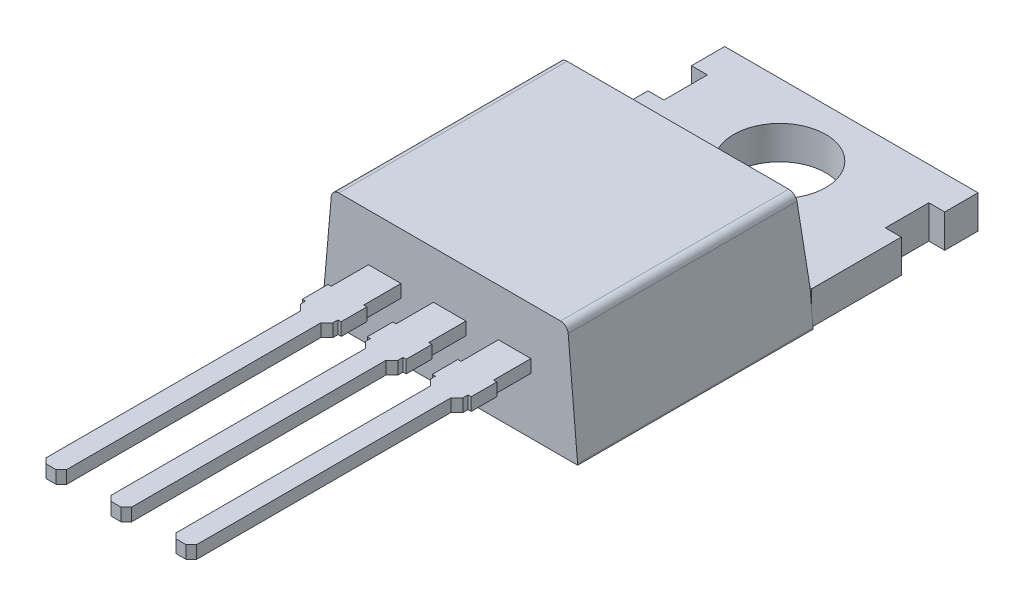
from build123d import *

# Parameters (mm, degrees)
BOSS_EXTRUDE1_DEPTH  = 9.2
FILLET1_R            = 0.3
CUT_EXTRUDE1_DEPTH   = 19.2
SKETCH3_W            = 9.9
SKETCH3_H            = 1.3
BOSS_EXTRUDE2_DEPTH  = 6.5
SKETCH4_W            = 0.621842352
SKETCH4_H            = 1.7
CUT_EXTRUDE3_DEPTH   = 16.5
SKETCH5_R            = 1.8
CUT_EXTRUDE4_DEPTH   = 16.5
SKETCH8_W            = 1.27
SKETCH8_H            = 0.5
BOSS_EXTRUDE4_DEPTH  = 1.46
SKETCH9_W            = 1.52
SKETCH9_H            = 0.5
BOSS_EXTRUDE5_DEPTH  = 1
SKETCH10_W           = 1.27
SKETCH10_H           = 0.5
BOSS_EXTRUDE6_DEPTH  = 0.5
SKETCH11_W           = 0.8
SKETCH11_H           = 0.5
BOSS_EXTRUDE7_DEPTH  = 10.08
CHAMFER1_SIZE        = 0.3
CHAMFER2_SIZE        = 0.2
BOSS_EXTRUDE10_DEPTH = 0.05


with BuildPart() as part:
    # Sketch1 → Boss-Extrude1 (new body)
    with BuildSketch(Plane.XY):
        Polygon((1.031077827, 0), (-8.968922173, 0), (-8.575223187, 4.5), (0.637378841, 4.5), align=None)
    extrude(amount=BOSS_EXTRUDE1_DEPTH)

    # Fillet1
    fillet1_edges = [part.edges().sort_by_distance(p)[0] for p in [
        (-8.575223187, 4.5, 4.6),
        (0.637378841, 4.5, 4.6),
    ]]
    fillet(fillet1_edges, radius=FILLET1_R)

    # Sketch2 → Cut-Extrude1 (cut)
    with BuildSketch(Plane(origin=(5, 0, 0), x_dir=(0, 0, -1), z_dir=(1, 0, 0))):
        Polygon((0, 4.5), (-0.279963723, 4.5), (0, 1.3), align=None)
    extrude(amount=-CUT_EXTRUDE1_DEPTH, mode=Mode.SUBTRACT)

    # Sketch3 → Boss-Extrude2 (add)
    with BuildSketch(Plane(origin=(0, 0, 0), x_dir=(-1, 0, 0), z_dir=(0, 0, -1))):
        with Locations((3.968922173, 0.65)):
            Rectangle(SKETCH3_W, SKETCH3_H)
    extrude(amount=BOSS_EXTRUDE2_DEPTH)

    # Sketch4 → Cut-Extrude3 (cut)
    with BuildSketch(Plane(origin=(0, 1.3, 0), x_dir=(1, 0, 0), z_dir=(0, 1, 0))):
        with Locations((-8.608000997, 4.35)):
            Rectangle(SKETCH4_W, SKETCH4_H)
        with Locations((0.670156651, 4.35)):
            Rectangle(SKETCH4_W, SKETCH4_H)
    extrude(amount=-CUT_EXTRUDE3_DEPTH, mode=Mode.SUBTRACT)

    # Sketch5 → Cut-Extrude4 (cut)
    with BuildSketch(Plane(origin=(0, 1.3, 0), x_dir=(1, 0, 0), z_dir=(0, 1, 0))):
        with Locations(Location((-3.968922173, 3.7, 0), (0, 0, 270))):
            Circle(SKETCH5_R)
    extrude(amount=-CUT_EXTRUDE4_DEPTH, mode=Mode.SUBTRACT)

    # Sketch8 → Boss-Extrude4 (add)
    with BuildSketch(Plane.XY.offset(9.2)):
        with Locations((-1.428922173, 2.4)):
            Rectangle(SKETCH8_W, SKETCH8_H)
        with Locations((-3.968922173, 2.4)):
            Rectangle(SKETCH8_W, SKETCH8_H)
        with Locations((-6.508922173, 2.4)):
            Rectangle(SKETCH8_W, SKETCH8_H)
    extrude(amount=BOSS_EXTRUDE4_DEPTH)

    # Sketch9 → Boss-Extrude5 (add)
    with BuildSketch(Plane.XY.offset(10.66)):
        with Locations((-3.968922173, 2.4)):
            Rectangle(SKETCH9_W, SKETCH9_H)
        with Locations((-1.428922173, 2.4)):
            Rectangle(SKETCH9_W, SKETCH9_H)
        with Locations((-6.508922173, 2.4)):
            Rectangle(SKETCH9_W, SKETCH9_H)
    extrude(amount=BOSS_EXTRUDE5_DEPTH)

    # Sketch10 → Boss-Extrude6 (add)
    with BuildSketch(Plane.XY.offset(11.66)):
        with Locations((-3.968922173, 2.4)):
            Rectangle(SKETCH10_W, SKETCH10_H)
        with Locations((-1.428922173, 2.4)):
            Rectangle(SKETCH10_W, SKETCH10_H)
        with Locations((-6.508922173, 2.4)):
            Rectangle(SKETCH10_W, SKETCH10_H)
    extrude(amount=BOSS_EXTRUDE6_DEPTH)

    # Sketch11 → Boss-Extrude7 (add)
    with BuildSketch(Plane.XY.offset(12.16)):
        with Locations((-3.968922173, 2.4)):
            Rectangle(SKETCH11_W, SKETCH11_H)
        with Locations((-1.428922173, 2.4)):
            Rectangle(SKETCH11_W, SKETCH11_H)
        with Locations((-6.508922173, 2.4)):
            Rectangle(SKETCH11_W, SKETCH11_H)
    extrude(amount=BOSS_EXTRUDE7_DEPTH)

    # Chamfer1
    # the kernel refuses this chamfer: 0.3 mm, written as the material it takes off along each edge
    with BuildSketch(Plane(origin=(-0.793922173, 3.421504896, 12.16), x_dir=(-0.9996219169112968, 0, 0.027495876610584464), z_dir=(0, -1, 0))) as chamfer1_piece_1_section:
        Polygon((CHAMFER1_SIZE * 0.999621916911, CHAMFER1_SIZE * 0.0274958766106), (-CHAMFER1_SIZE * 0.0274958766106, CHAMFER1_SIZE * 0.999621916911), (0, 0), align=None)
    chamfer1_piece_1 = extrude(amount=2.043009793, mode=Mode.PRIVATE)
    chamfer1_piece_1 = split(chamfer1_piece_1, bisect_by=Plane(origin=(-1.028922173, 2.4, 12.055687512), z_dir=(1, 0, 0)), keep=Keep.TOP, mode=Mode.PRIVATE)
    add(chamfer1_piece_1, mode=Mode.SUBTRACT)
    with BuildSketch(Plane(origin=(-2.063922173, 1.378495104, 12.16), x_dir=(-0.027495876610585904, 0, -0.9996219169112968), z_dir=(0, 1, 0))) as chamfer1_piece_2_section:
        Polygon((CHAMFER1_SIZE * 0.999621916911, -CHAMFER1_SIZE * 0.0274958766106), (-CHAMFER1_SIZE * 0.0274958766106, -CHAMFER1_SIZE * 0.999621916911), (0, 0), align=None)
    chamfer1_piece_2 = extrude(amount=2.043009793, mode=Mode.PRIVATE)
    chamfer1_piece_2 = split(chamfer1_piece_2, bisect_by=Plane(origin=(-1.828922173, 2.4, 12.055687512), z_dir=(-1, 0, 0)), keep=Keep.TOP, mode=Mode.PRIVATE)
    add(chamfer1_piece_2, mode=Mode.SUBTRACT)
    with BuildSketch(Plane(origin=(-4.603922173, 1.378495104, 12.16), x_dir=(-0.027495876610587344, 0, -0.9996219169112968), z_dir=(0, 1, 0))) as chamfer1_piece_3_section:
        Polygon((CHAMFER1_SIZE * 0.999621916911, -CHAMFER1_SIZE * 0.0274958766106), (-CHAMFER1_SIZE * 0.0274958766106, -CHAMFER1_SIZE * 0.999621916911), (0, 0), align=None)
    chamfer1_piece_3 = extrude(amount=2.043009793, mode=Mode.PRIVATE)
    chamfer1_piece_3 = split(chamfer1_piece_3, bisect_by=Plane(origin=(-4.368922173, 2.4, 12.055687512), z_dir=(-1, 0, 0)), keep=Keep.TOP, mode=Mode.PRIVATE)
    add(chamfer1_piece_3, mode=Mode.SUBTRACT)
    with BuildSketch(Plane(origin=(-3.333922173, 3.421504896, 12.16), x_dir=(-0.9996219169112968, 0, 0.027495876610584506), z_dir=(0, -1, 0))) as chamfer1_piece_4_section:
        Polygon((CHAMFER1_SIZE * 0.999621916911, CHAMFER1_SIZE * 0.0274958766106), (-CHAMFER1_SIZE * 0.0274958766106, CHAMFER1_SIZE * 0.999621916911), (0, 0), align=None)
    chamfer1_piece_4 = extrude(amount=2.043009793, mode=Mode.PRIVATE)
    chamfer1_piece_4 = split(chamfer1_piece_4, bisect_by=Plane(origin=(-3.568922173, 2.4, 12.055687512), z_dir=(1, 0, 0)), keep=Keep.TOP, mode=Mode.PRIVATE)
    add(chamfer1_piece_4, mode=Mode.SUBTRACT)
    with BuildSketch(Plane(origin=(-7.143922173, 1.378495104, 12.16), x_dir=(-0.027495876610587344, 0, -0.9996219169112968), z_dir=(0, 1, 0))) as chamfer1_piece_5_section:
        Polygon((CHAMFER1_SIZE * 0.999621916911, -CHAMFER1_SIZE * 0.0274958766106), (-CHAMFER1_SIZE * 0.0274958766106, -CHAMFER1_SIZE * 0.999621916911), (0, 0), align=None)
    chamfer1_piece_5 = extrude(amount=2.043009793, mode=Mode.PRIVATE)
    chamfer1_piece_5 = split(chamfer1_piece_5, bisect_by=Plane(origin=(-6.908922173, 2.4, 12.055687512), z_dir=(-1, 0, 0)), keep=Keep.TOP, mode=Mode.PRIVATE)
    add(chamfer1_piece_5, mode=Mode.SUBTRACT)
    with BuildSketch(Plane(origin=(-5.873922173, 3.421504896, 12.16), x_dir=(-0.9996219169112968, 0, 0.027495876610584464), z_dir=(0, -1, 0))) as chamfer1_piece_6_section:
        Polygon((CHAMFER1_SIZE * 0.999621916911, CHAMFER1_SIZE * 0.0274958766106), (-CHAMFER1_SIZE * 0.0274958766106, CHAMFER1_SIZE * 0.999621916911), (0, 0), align=None)
    chamfer1_piece_6 = extrude(amount=2.043009793, mode=Mode.PRIVATE)
    chamfer1_piece_6 = split(chamfer1_piece_6, bisect_by=Plane(origin=(-6.108922173, 2.4, 12.055687512), z_dir=(1, 0, 0)), keep=Keep.TOP, mode=Mode.PRIVATE)
    add(chamfer1_piece_6, mode=Mode.SUBTRACT)

    # Chamfer2
    chamfer2_edges = [part.edges().sort_by_distance(p)[0] for p in [
        (-3.568922173, 2.4, 22.24),
        (-4.368922173, 2.4, 22.24),
        (-6.108922173, 2.4, 22.24),
        (-6.908922173, 2.4, 22.24),
        (-1.028922173, 2.4, 22.24),
        (-1.828922173, 2.4, 22.24),
    ]]
    chamfer(chamfer2_edges, length=CHAMFER2_SIZE)

    # Sketch15 → Boss-Extrude10 (add)
    with BuildSketch(Plane(origin=(0, 0, 0), x_dir=(-1, 0, 0), z_dir=(0, -1, 0))):
        Polygon((8.968922173, 0), (7.937844346, 0), (7.937844346, -8.229840369), (0, -8.229840369), (0, 0), (-1.031077827, 0), (-1.031077827, -9.2), (8.968922173, -9.2), align=None)
    extrude(amount=BOSS_EXTRUDE10_DEPTH)


solid = part.part
